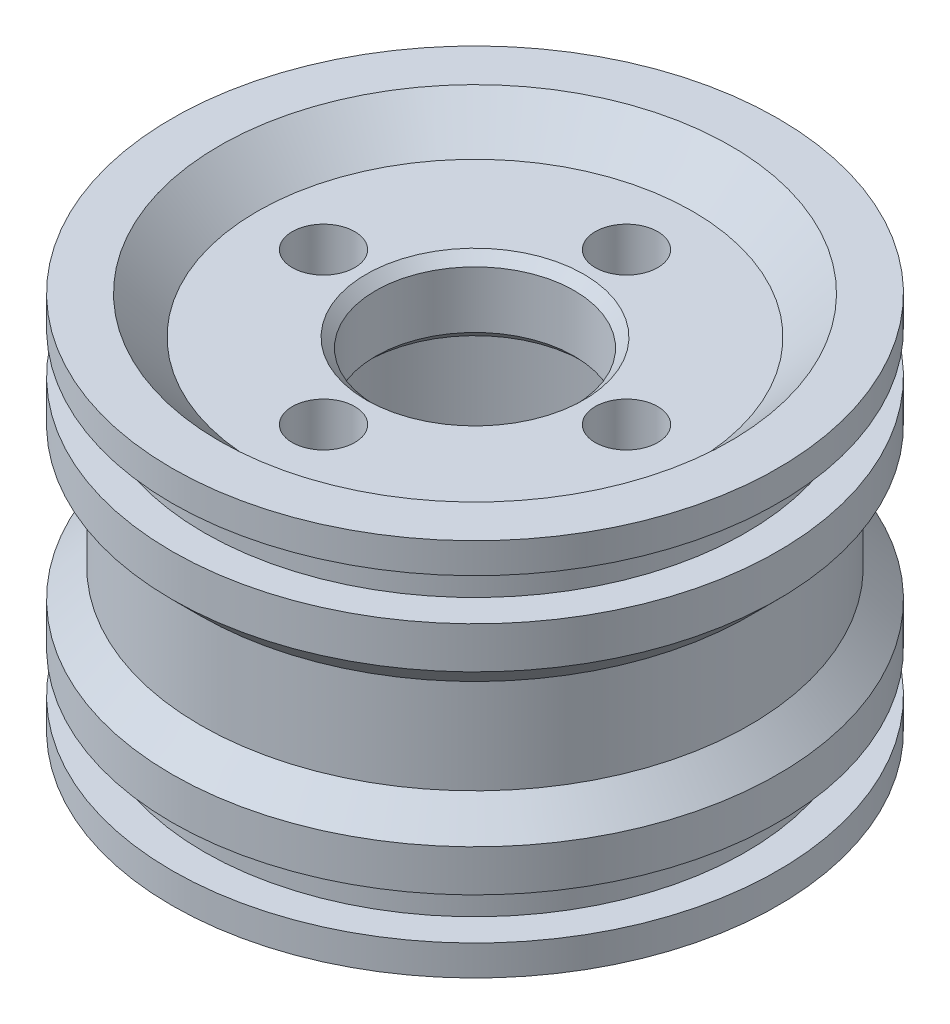
from build123d import *

# Parameters (mm, degrees)
SKETCH_1_R               = 16
EXTRUDE_1_DEPTH          = 10
SKETCH_2_W               = 1.7
SKETCH_2_H               = 2.2
SKETCH_4_R               = 11.5
CUT_EXTRUDE_1_DEPTH      = 14
SKETCH_5_R               = 5.25
CUT_EXTRUDE_2_DEPTH      = 15
CHAMFER_1_SIZE           = 2
CUT_EXTRUDE_START        = -2
SKETCH_6_R               = 11.5
SKETCH_6_R_2             = 5
CUT_EXTRUDE_3_DEPTH      = 2
CHAMFER_2_SIZE           = 2
SKETCH_8_R               = 1.65
CUT_EXTRUDE_4_DEPTH      = 10
PATTERN_CIRCULAR_1_COUNT = 4
SKETCH_7_W               = 1.5
SKETCH_7_H               = 8
CHAMFER_5_SIZE           = 1.5
CHAMFER_4_SIZE           = 0.5


with BuildPart() as part:
    # 草图1 → 凸台-拉伸1 (new, symmetric)
    with BuildSketch(Plane(origin=(0, 0, 0), x_dir=(1, 0, 0), z_dir=(0, 1, 0))):
        with Locations(Location((0, 0, 0), (0, 0, 270))):
            Circle(SKETCH_1_R)
    extrude(amount=EXTRUDE_1_DEPTH, both=True)

    # 草图2 → 切除-旋转1 (revolve, cut)
    with BuildSketch(Plane.XY, mode=Mode.PRIVATE) as cut_revolve_1_sk:
        with Locations((15.15, 7.3)):
            Rectangle(SKETCH_2_W, SKETCH_2_H)
    cut_revolve_1 = revolve(cut_revolve_1_sk.sketch.rotate(Axis((0, 8.4, 0), (0, -1, 0)), 90), axis=Axis((0, 8.4, 0), (0, -1, 0)), mode=Mode.SUBTRACT)

    # 镜向1: 切除-旋转1 across plane
    add(cut_revolve_1.mirror(Plane.ZX), mode=Mode.SUBTRACT)

    # 草图4 → 切除-拉伸1 (cut)
    with BuildSketch(Plane.XZ.offset(10)):
        with Locations(Location((0, 0, 0), (0, 0, 270))):
            Circle(SKETCH_4_R)
    extrude(amount=-CUT_EXTRUDE_1_DEPTH, mode=Mode.SUBTRACT)

    # 草图5 → 切除-拉伸2 (cut)
    with BuildSketch(Plane(origin=(0, 10, 0), x_dir=(1, 0, 0), z_dir=(0, 1, 0))):
        with Locations(Location((0, 0, 0), (0, 0, 270))):
            Circle(SKETCH_5_R)
    extrude(amount=-CUT_EXTRUDE_2_DEPTH, mode=Mode.SUBTRACT)

    # 倒角1
    chamfer_1_edges = [part.edges().sort_by_distance(p)[0] for p in [
        (0, -10, 11.5),
    ]]
    chamfer(chamfer_1_edges, length=CHAMFER_1_SIZE)

    # 草图6 → 切除-拉伸3 (cut)
    with BuildSketch(Plane(origin=(0, 10, 0), x_dir=(1, 0, 0), z_dir=(0, 1, 0)).offset(CUT_EXTRUDE_START)):
        with Locations(Location((0, 0, 0), (0, 0, 90))):
            Circle(SKETCH_6_R)
        Circle(SKETCH_6_R_2, mode=Mode.SUBTRACT)
    extrude(amount=CUT_EXTRUDE_3_DEPTH, mode=Mode.SUBTRACT)

    # 倒角2
    chamfer_2_edges = [part.edges().sort_by_distance(p)[0] for p in [
        (0, 10, 11.5),
    ]]
    chamfer(chamfer_2_edges, length=CHAMFER_2_SIZE - 0.0001)  # a hair under: the kernel refuses the full size

    # 草图8 → 切除-拉伸4 (cut)
    with BuildSketch(Plane.XZ.offset(-4)):
        with Locations(Location((-8, 0, 0), (0, 0, 270))):
            Circle(SKETCH_8_R)
    cut_extrude_4 = extrude(amount=-CUT_EXTRUDE_4_DEPTH, mode=Mode.SUBTRACT)

    # 阵列(圆周)1: 切除-拉伸4 ×4 about axis
    pattern_circular_1_axis = Axis((0, 0, 0), (0, 1, 0))
    for i in range(1, PATTERN_CIRCULAR_1_COUNT):
        add(cut_extrude_4.rotate(pattern_circular_1_axis, i * 360 / PATTERN_CIRCULAR_1_COUNT), mode=Mode.SUBTRACT)

    # 草图7 → 切除-旋转2 (revolve, cut)
    with BuildSketch(Plane(origin=(0, 0, 0), x_dir=(0, 0, -1), z_dir=(1, 0, 0))):
        with Locations((15.25, 0)):
            Rectangle(SKETCH_7_W, SKETCH_7_H)
    revolve(axis=Axis((0, 4, 0), (0, 1, 0)), mode=Mode.SUBTRACT)

    # 倒角5
    chamfer_5_edges = [part.edges().sort_by_distance(p)[0] for p in [
        (0, -4, 14.5),
        (0, 4, 14.5),
    ]]
    chamfer(chamfer_5_edges, length=CHAMFER_5_SIZE - 0.0001)  # a hair under: the kernel refuses the full size

    # 倒角4
    chamfer_4_edges = [part.edges().sort_by_distance(p)[0] for p in [
        (0, 4, 11.5),
        (0, 4, -5.25),
        (0, 8, -5.25),
    ]]
    chamfer(chamfer_4_edges, length=CHAMFER_4_SIZE)


solid = part.part
